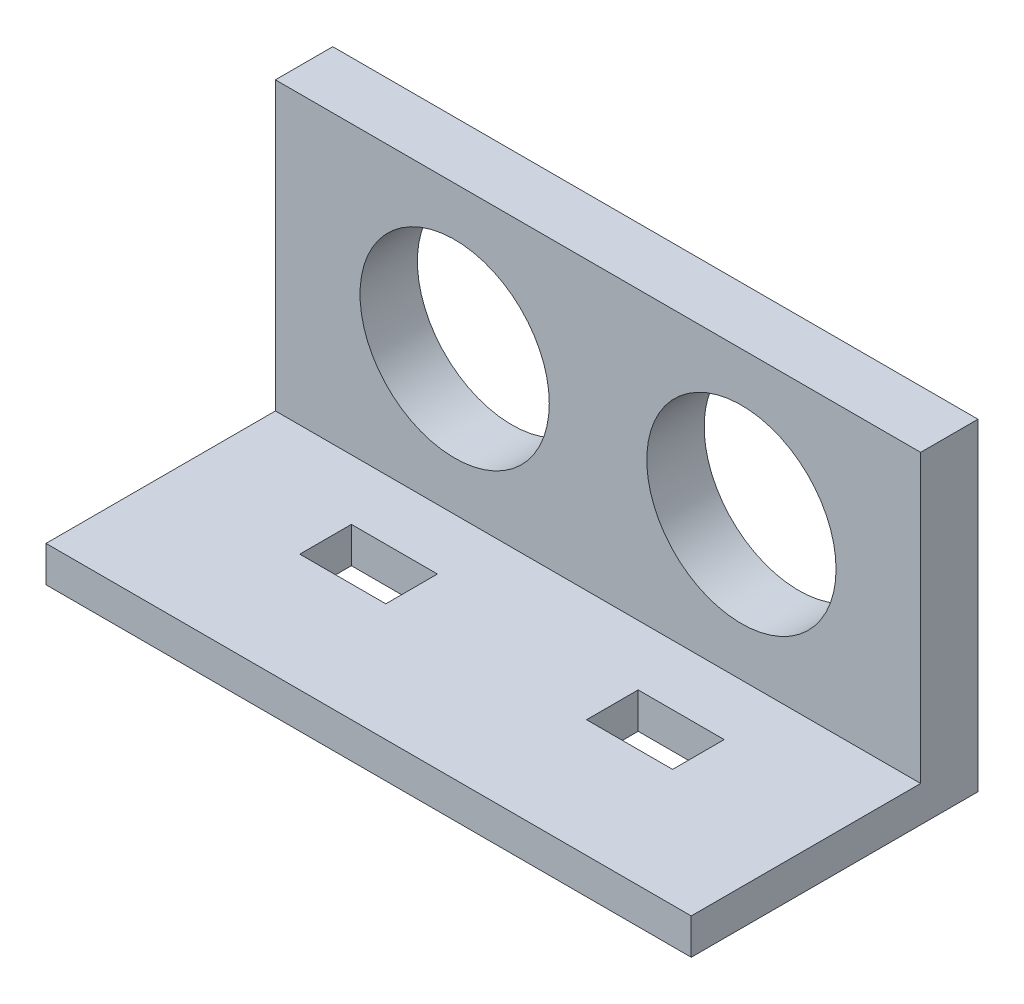
from build123d import *

# Parameters (mm, degrees)
SKETCH1_W           = 57.15
SKETCH1_H           = 25.4
SKETCH1_R           = 8.382
BOSS_EXTRUDE1_DEPTH = 5.08
SKETCH3_W           = 25.4
SKETCH3_H           = 3.175
BOSS_EXTRUDE2_DEPTH = 57.15
SKETCH4_W           = 7.62
SKETCH4_H           = 4.572
CUT_EXTRUDE1_DEPTH  = 5.08
SKETCH5_W           = 5.08
SKETCH5_H           = 5.08
BOSS_EXTRUDE3_DEPTH = 2.54
CHAMFER1_SIZE       = 2.54


with BuildPart() as part:
    # Sketch1 → Boss-Extrude1 (new body)
    with BuildSketch(Plane.XY):
        Rectangle(SKETCH1_W, SKETCH1_H)
        with Locations((-12.7, 0)):
            Circle(SKETCH1_R, mode=Mode.SUBTRACT)
        with Locations((12.7, 0)):
            Circle(SKETCH1_R, mode=Mode.SUBTRACT)
    extrude(amount=-BOSS_EXTRUDE1_DEPTH)

    # Sketch3 → Boss-Extrude2 (add)
    with BuildSketch(Plane.ZY.offset(28.575)):
        with Locations((7.62, -14.2875)):
            Rectangle(SKETCH3_W, SKETCH3_H)
    extrude(amount=-BOSS_EXTRUDE2_DEPTH)

    # Sketch4 → Cut-Extrude1 (cut)
    with BuildSketch(Plane(origin=(0, -12.7, 0), x_dir=(1, 0, 0), z_dir=(0, 1, 0))):
        with Locations((-12.7, -7.62)):
            Rectangle(SKETCH4_W, SKETCH4_H)
        with Locations((12.7, -7.62)):
            Rectangle(SKETCH4_W, SKETCH4_H)
    extrude(amount=-CUT_EXTRUDE1_DEPTH, mode=Mode.SUBTRACT)

    # Sketch5 → Boss-Extrude3 (add)
    with BuildSketch(Plane.XZ.offset(15.875)):
        with Locations((-23.495, 7.62)):
            Rectangle(SKETCH5_W, SKETCH5_H)
        with Locations((23.495, 7.62)):
            Rectangle(SKETCH5_W, SKETCH5_H)
    extrude(amount=BOSS_EXTRUDE3_DEPTH)

    # Chamfer1
    chamfer1_edges = [part.edges().sort_by_distance(p)[0] for p in [
        (26.035, -18.415, 7.62),
        (-26.035, -18.415, 7.62),
    ]]
    chamfer(chamfer1_edges, length=CHAMFER1_SIZE - 0.0001)  # a hair under: the kernel refuses the full size


solid = part.part
